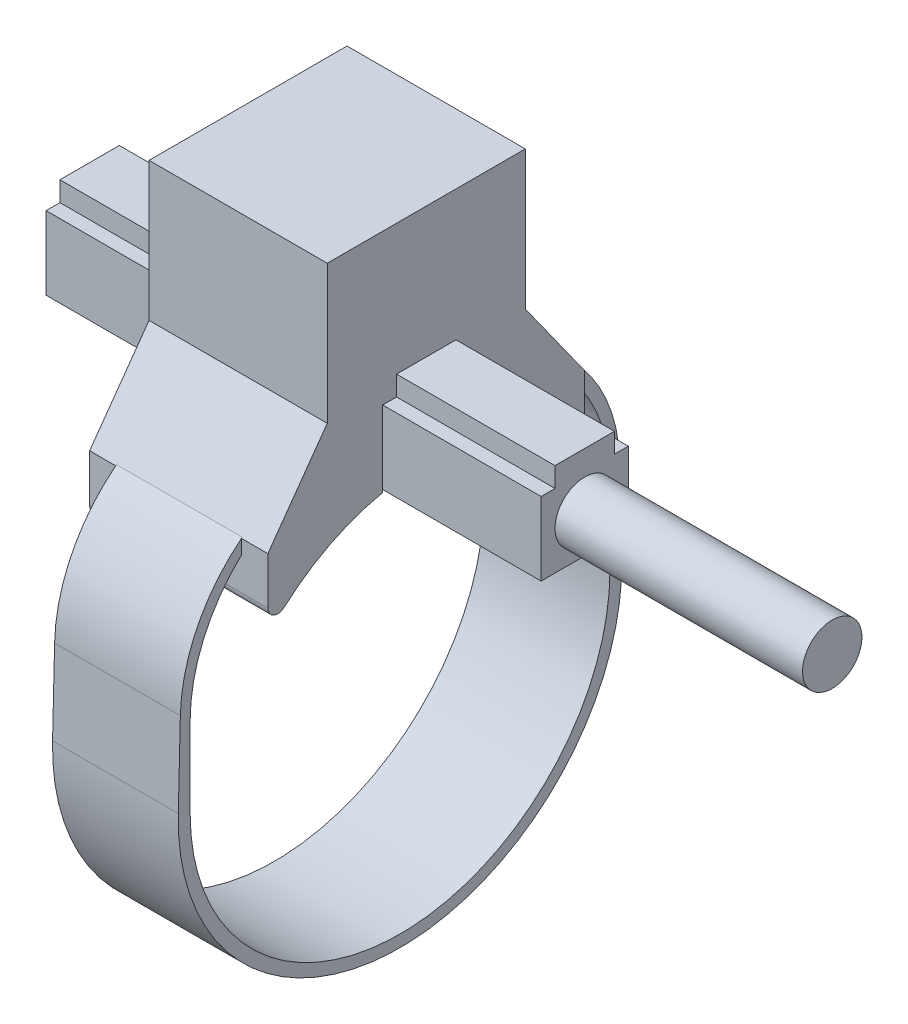
from build123d import *

# Parameters (mm, degrees)
EXTRUDE_1_DEPTH      = 4.5
EXTRUDE_1_DEPTH_BACK = 4.5
EXTRUDE_2_DEPTH      = 3.175
EXTRUDE_2_DEPTH_BACK = 3.175
EXTRUDE_3_DEPTH      = 12.5
EXTRUDE_3_DEPTH_BACK = 12.5
SKETCH_4_R           = 1.5
EXTRUDE_4_DEPTH      = 25


with BuildPart() as part:
    # 草图1 → 凸台-拉伸1 (new, two sides: drawn at the far end of the back side and taken through both)
    with BuildSketch(Plane(origin=(11.5, 0, 0), x_dir=(0, 0, -1), z_dir=(1, 0, 0)).offset(-EXTRUDE_1_DEPTH_BACK)):
        with BuildLine():
            Line((-8, 10.7), (-8, 8.318052657))
            ThreePointArc((-8, 8.318052657), (-7.703210834, 7.861209842), (-7.165178571, 7.94671102))
            ThreePointArc((-7.165178571, 7.94671102), (-4.849756993, 9.537811966), (-2.2, 10.471389593))
            Line((-2.2, 10.471389593), (-2.2, 13.9))
            Line((-2.2, 13.9), (-1.5, 13.9))
            Line((-1.5, 13.9), (-1.5, 14.9))
            Line((-1.5, 14.9), (1.5, 14.9))
            Line((1.5, 14.9), (1.5, 13.9))
            Line((1.5, 13.9), (2.2, 13.9))
            Line((2.2, 13.9), (2.2, 10.471389593))
            ThreePointArc((2.2, 10.471389593), (4.849756993, 9.537811966), (7.165178571, 7.94671102))
            ThreePointArc((7.165178571, 7.94671102), (7.703210834, 7.861209842), (8, 8.318052657))
            Line((8, 8.318052657), (8, 10.7))
            Line((8, 10.7), (5, 14.9))
            Line((5, 14.9), (5, 21.9))
            Line((5, 21.9), (-5, 21.9))
            Line((-5, 21.9), (-5, 14.9))
            Line((-5, 14.9), (-8, 10.7))
        make_face()
    extrude(amount=EXTRUDE_1_DEPTH + EXTRUDE_1_DEPTH_BACK)

    # 草图2 → 凸台-拉伸2 (add, two sides: drawn at the far end of the back side and taken through both)
    with BuildSketch(Plane(origin=(11.5, 0, 0), x_dir=(0, 0, -1), z_dir=(1, 0, 0)).offset(-EXTRUDE_2_DEPTH_BACK)):
        with BuildLine():
            Line((11.19670458, 0.271673606), (11.094136285, 4.49890389))
            ThreePointArc((11.094136285, 4.49890389), (8.624069763, 10.168177396), (2.896549003, 12.5))
            Line((2.896549003, 12.5), (-2.896549003, 12.5))
            ThreePointArc((-2.896549003, 12.5), (-8.624069763, 10.168177396), (-11.094136285, 4.49890389))
            Line((-11.094136285, 4.49890389), (-11.19670458, 0.271673606))
            ThreePointArc((-11.19670458, 0.271673606), (0, -11.2), (11.19670458, 0.271673606))
        make_face()
        with BuildLine():
            Line((10.6, 0), (10.6, 4))
            ThreePointArc((10.6, 4), (8.198275606, 9.798275606), (2.4, 12.2))
            Line((2.4, 12.2), (-2.4, 12.2))
            ThreePointArc((-2.4, 12.2), (-8.198275606, 9.798275606), (-10.6, 4))
            Line((-10.6, 4), (-10.6, 0))
            ThreePointArc((-10.6, 0), (0, -10.6), (10.6, 0))
        make_face(mode=Mode.SUBTRACT)
    extrude(amount=EXTRUDE_2_DEPTH + EXTRUDE_2_DEPTH_BACK)

    # 草图3 → 凸台-拉伸3 (add, two sides: drawn at the far end of the back side and taken through both)
    with BuildSketch(Plane(origin=(11.5, 0, 0), x_dir=(0, 0, -1), z_dir=(1, 0, 0)).offset(-EXTRUDE_3_DEPTH_BACK)):
        Polygon((-2.2, 14.3), (-2.2, 10.6), (2.2, 10.6), (2.2, 14.3), (1.5, 14.3), (1.5, 15.3), (-1.5, 15.3), (-1.5, 14.3), align=None)
    extrude(amount=EXTRUDE_3_DEPTH + EXTRUDE_3_DEPTH_BACK)

    # 草图4 → 凸台-拉伸4 (add)
    with BuildSketch(Plane(origin=(11.5, 0, 0), x_dir=(0, 0, -1), z_dir=(1, 0, 0))):
        with Locations((0, 12.55)):
            Circle(SKETCH_4_R)
    extrude(amount=EXTRUDE_4_DEPTH)


solid = part.part
